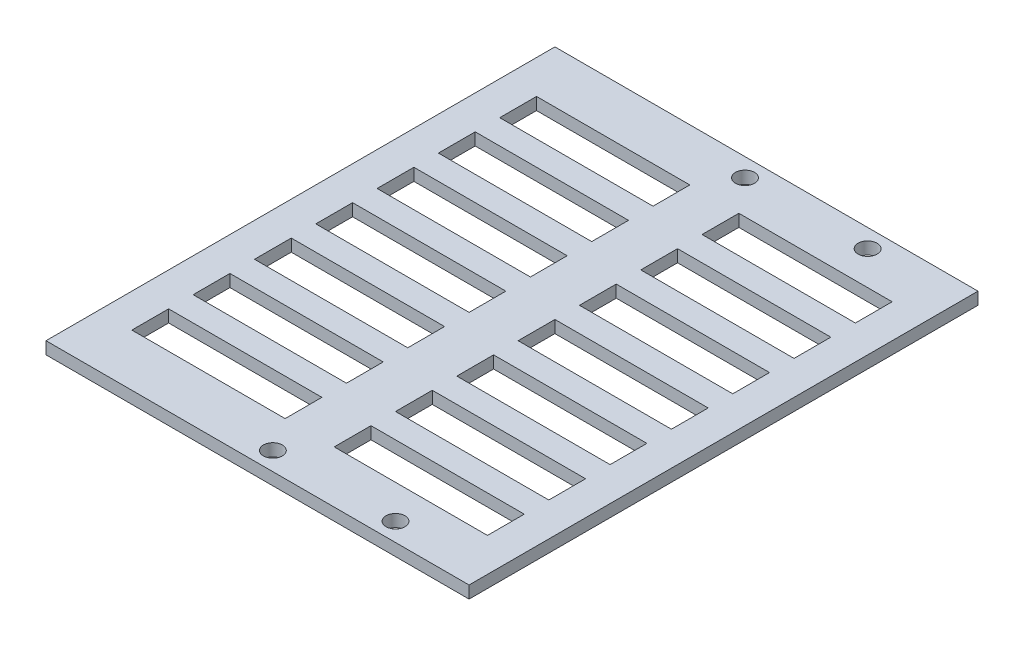
from build123d import *

# Parameters (mm, degrees)
SKETCH_2_W                 = 69
SKETCH_2_H                 = 83
EXTRUDE_1_DEPTH            = 2
SKETCH_3_R                 = 1.55
CUT_EXTRUDE_1_DEPTH        = 14
SKETCH1_W                  = 25
SKETCH1_H                  = 6
CUT_EXTRUDE1_DEPTH         = 10
LPATTERN1_COUNT            = 4
LPATTERN1_PITCH            = 10
LPATTERN2_COPY_1_SKETCH_W  = 25
LPATTERN2_COPY_1_SKETCH_H  = 6
LPATTERN2_COPY_1_DEPTH     = 10
LPATTERN2_COPY_2_SKETCH_W  = 25
LPATTERN2_COPY_2_SKETCH_H  = 6
LPATTERN2_COPY_2_DEPTH     = 10
LPATTERN2_COPY_3_SKETCH_W  = 25
LPATTERN2_COPY_3_SKETCH_H  = 6
LPATTERN2_COPY_3_DEPTH     = 10
LPATTERN2_COPY_4_SKETCH_W  = 25
LPATTERN2_COPY_4_SKETCH_H  = 6
LPATTERN2_COPY_4_DEPTH     = 10
LPATTERN2_COPY_5_SKETCH_W  = 25
LPATTERN2_COPY_5_SKETCH_H  = 6
LPATTERN2_COPY_5_DEPTH     = 10
LPATTERN2_COPY_6_SKETCH_W  = 25
LPATTERN2_COPY_6_SKETCH_H  = 6
LPATTERN2_COPY_6_DEPTH     = 10
LPATTERN2_COPY_7_SKETCH_W  = 25
LPATTERN2_COPY_7_SKETCH_H  = 6
LPATTERN2_COPY_7_DEPTH     = 10
LPATTERN2_COPY_8_SKETCH_W  = 25
LPATTERN2_COPY_8_SKETCH_H  = 6
LPATTERN2_COPY_8_DEPTH     = 10
LPATTERN2_COPY_9_SKETCH_W  = 25
LPATTERN2_COPY_9_SKETCH_H  = 6
LPATTERN2_COPY_9_DEPTH     = 10
LPATTERN2_COPY_10_SKETCH_W = 25
LPATTERN2_COPY_10_SKETCH_H = 6
LPATTERN2_COPY_10_DEPTH    = 10
LPATTERN2_COPY_11_SKETCH_W = 25
LPATTERN2_COPY_11_SKETCH_H = 6
LPATTERN2_COPY_11_DEPTH    = 10
LPATTERN2_COPY_12_SKETCH_W = 25
LPATTERN2_COPY_12_SKETCH_H = 6
LPATTERN2_COPY_12_DEPTH    = 10


with BuildPart() as part:
    # 草图2 → 凸台-拉伸1 (new body)
    with BuildSketch(Plane(origin=(0, 0, 0), x_dir=(1, 0, 0), z_dir=(0, 1, 0))):
        with Locations((-34.5, 41.5)):
            Rectangle(SKETCH_2_W, SKETCH_2_H)
    extrude(amount=EXTRUDE_1_DEPTH)

    # 草图3 → 切除-拉伸1 (cut)
    with BuildSketch(Plane(origin=(0, 2, 0), x_dir=(1, 0, 0), z_dir=(0, 1, 0))):
        with Locations((-35, 80)):
            Circle(SKETCH_3_R)
        with Locations((-15, 80)):
            Circle(SKETCH_3_R)
        with Locations((-15, 3)):
            Circle(SKETCH_3_R)
        with Locations((-35, 3)):
            Circle(SKETCH_3_R)
    extrude(amount=-CUT_EXTRUDE_1_DEPTH, mode=Mode.SUBTRACT)

    # Sketch1 → Cut-Extrude1 (cut)
    with BuildSketch(Plane(origin=(0, 2, 0), x_dir=(1, 0, 0), z_dir=(0, 1, 0))):
        with Locations((-18, 41.5)):
            Rectangle(SKETCH1_W, SKETCH1_H)
        with Locations((-51, 41.5)):
            Rectangle(SKETCH1_W, SKETCH1_H)
    cut_extrude1 = extrude(amount=-CUT_EXTRUDE1_DEPTH, mode=Mode.SUBTRACT)

    # LPattern1: Cut-Extrude1 ×4
    with Locations(*[(0, 0, i * LPATTERN1_PITCH) for i in range(1, LPATTERN1_COUNT)]):
        add(cut_extrude1, mode=Mode.SUBTRACT)

    # LPattern2 copy 1 sketch → LPattern2 copy 1 (cut)
    with BuildSketch(Plane(origin=(0, 2, 0), x_dir=(1, 0, 0), z_dir=(0, 1, 0))):
        with Locations((-18, 41.5)):
            Rectangle(LPATTERN2_COPY_1_SKETCH_W, LPATTERN2_COPY_1_SKETCH_H)
        with Locations((-51, 41.5)):
            Rectangle(LPATTERN2_COPY_1_SKETCH_W, LPATTERN2_COPY_1_SKETCH_H)
    extrude(amount=-LPATTERN2_COPY_1_DEPTH, mode=Mode.SUBTRACT)

    # LPattern2 copy 2 sketch → LPattern2 copy 2 (cut)
    with BuildSketch(Plane(origin=(0, 2, -10), x_dir=(1, 0, 0), z_dir=(0, 1, 0))):
        with Locations((-18, 41.5)):
            Rectangle(LPATTERN2_COPY_2_SKETCH_W, LPATTERN2_COPY_2_SKETCH_H)
        with Locations((-51, 41.5)):
            Rectangle(LPATTERN2_COPY_2_SKETCH_W, LPATTERN2_COPY_2_SKETCH_H)
    extrude(amount=-LPATTERN2_COPY_2_DEPTH, mode=Mode.SUBTRACT)

    # LPattern2 copy 3 sketch → LPattern2 copy 3 (cut)
    with BuildSketch(Plane(origin=(0, 2, -20), x_dir=(1, 0, 0), z_dir=(0, 1, 0))):
        with Locations((-18, 41.5)):
            Rectangle(LPATTERN2_COPY_3_SKETCH_W, LPATTERN2_COPY_3_SKETCH_H)
        with Locations((-51, 41.5)):
            Rectangle(LPATTERN2_COPY_3_SKETCH_W, LPATTERN2_COPY_3_SKETCH_H)
    extrude(amount=-LPATTERN2_COPY_3_DEPTH, mode=Mode.SUBTRACT)

    # LPattern2 copy 4 sketch → LPattern2 copy 4 (cut)
    with BuildSketch(Plane(origin=(0, 2, 10), x_dir=(1, 0, 0), z_dir=(0, 1, 0))):
        with Locations((-18, 41.5)):
            Rectangle(LPATTERN2_COPY_4_SKETCH_W, LPATTERN2_COPY_4_SKETCH_H)
        with Locations((-51, 41.5)):
            Rectangle(LPATTERN2_COPY_4_SKETCH_W, LPATTERN2_COPY_4_SKETCH_H)
    extrude(amount=-LPATTERN2_COPY_4_DEPTH, mode=Mode.SUBTRACT)

    # LPattern2 copy 5 sketch → LPattern2 copy 5 (cut)
    with BuildSketch(Plane(origin=(0, 2, 0), x_dir=(1, 0, 0), z_dir=(0, 1, 0))):
        with Locations((-18, 41.5)):
            Rectangle(LPATTERN2_COPY_5_SKETCH_W, LPATTERN2_COPY_5_SKETCH_H)
        with Locations((-51, 41.5)):
            Rectangle(LPATTERN2_COPY_5_SKETCH_W, LPATTERN2_COPY_5_SKETCH_H)
    extrude(amount=-LPATTERN2_COPY_5_DEPTH, mode=Mode.SUBTRACT)

    # LPattern2 copy 6 sketch → LPattern2 copy 6 (cut)
    with BuildSketch(Plane(origin=(0, 2, -10), x_dir=(1, 0, 0), z_dir=(0, 1, 0))):
        with Locations((-18, 41.5)):
            Rectangle(LPATTERN2_COPY_6_SKETCH_W, LPATTERN2_COPY_6_SKETCH_H)
        with Locations((-51, 41.5)):
            Rectangle(LPATTERN2_COPY_6_SKETCH_W, LPATTERN2_COPY_6_SKETCH_H)
    extrude(amount=-LPATTERN2_COPY_6_DEPTH, mode=Mode.SUBTRACT)

    # LPattern2 copy 7 sketch → LPattern2 copy 7 (cut)
    with BuildSketch(Plane(origin=(0, 2, 20), x_dir=(1, 0, 0), z_dir=(0, 1, 0))):
        with Locations((-18, 41.5)):
            Rectangle(LPATTERN2_COPY_7_SKETCH_W, LPATTERN2_COPY_7_SKETCH_H)
        with Locations((-51, 41.5)):
            Rectangle(LPATTERN2_COPY_7_SKETCH_W, LPATTERN2_COPY_7_SKETCH_H)
    extrude(amount=-LPATTERN2_COPY_7_DEPTH, mode=Mode.SUBTRACT)

    # LPattern2 copy 8 sketch → LPattern2 copy 8 (cut)
    with BuildSketch(Plane(origin=(0, 2, 10), x_dir=(1, 0, 0), z_dir=(0, 1, 0))):
        with Locations((-18, 41.5)):
            Rectangle(LPATTERN2_COPY_8_SKETCH_W, LPATTERN2_COPY_8_SKETCH_H)
        with Locations((-51, 41.5)):
            Rectangle(LPATTERN2_COPY_8_SKETCH_W, LPATTERN2_COPY_8_SKETCH_H)
    extrude(amount=-LPATTERN2_COPY_8_DEPTH, mode=Mode.SUBTRACT)

    # LPattern2 copy 9 sketch → LPattern2 copy 9 (cut)
    with BuildSketch(Plane(origin=(0, 2, 0), x_dir=(1, 0, 0), z_dir=(0, 1, 0))):
        with Locations((-18, 41.5)):
            Rectangle(LPATTERN2_COPY_9_SKETCH_W, LPATTERN2_COPY_9_SKETCH_H)
        with Locations((-51, 41.5)):
            Rectangle(LPATTERN2_COPY_9_SKETCH_W, LPATTERN2_COPY_9_SKETCH_H)
    extrude(amount=-LPATTERN2_COPY_9_DEPTH, mode=Mode.SUBTRACT)

    # LPattern2 copy 10 sketch → LPattern2 copy 10 (cut)
    with BuildSketch(Plane(origin=(0, 2, -10), x_dir=(1, 0, 0), z_dir=(0, 1, 0))):
        with Locations((-18, 41.5)):
            Rectangle(LPATTERN2_COPY_10_SKETCH_W, LPATTERN2_COPY_10_SKETCH_H)
        with Locations((-51, 41.5)):
            Rectangle(LPATTERN2_COPY_10_SKETCH_W, LPATTERN2_COPY_10_SKETCH_H)
    extrude(amount=-LPATTERN2_COPY_10_DEPTH, mode=Mode.SUBTRACT)

    # LPattern2 copy 11 sketch → LPattern2 copy 11 (cut)
    with BuildSketch(Plane(origin=(0, 2, -20), x_dir=(1, 0, 0), z_dir=(0, 1, 0))):
        with Locations((-18, 41.5)):
            Rectangle(LPATTERN2_COPY_11_SKETCH_W, LPATTERN2_COPY_11_SKETCH_H)
        with Locations((-51, 41.5)):
            Rectangle(LPATTERN2_COPY_11_SKETCH_W, LPATTERN2_COPY_11_SKETCH_H)
    extrude(amount=-LPATTERN2_COPY_11_DEPTH, mode=Mode.SUBTRACT)

    # LPattern2 copy 12 sketch → LPattern2 copy 12 (cut)
    with BuildSketch(Plane(origin=(0, 2, -30), x_dir=(1, 0, 0), z_dir=(0, 1, 0))):
        with Locations((-18, 41.5)):
            Rectangle(LPATTERN2_COPY_12_SKETCH_W, LPATTERN2_COPY_12_SKETCH_H)
        with Locations((-51, 41.5)):
            Rectangle(LPATTERN2_COPY_12_SKETCH_W, LPATTERN2_COPY_12_SKETCH_H)
    extrude(amount=-LPATTERN2_COPY_12_DEPTH, mode=Mode.SUBTRACT)


solid = part.part
